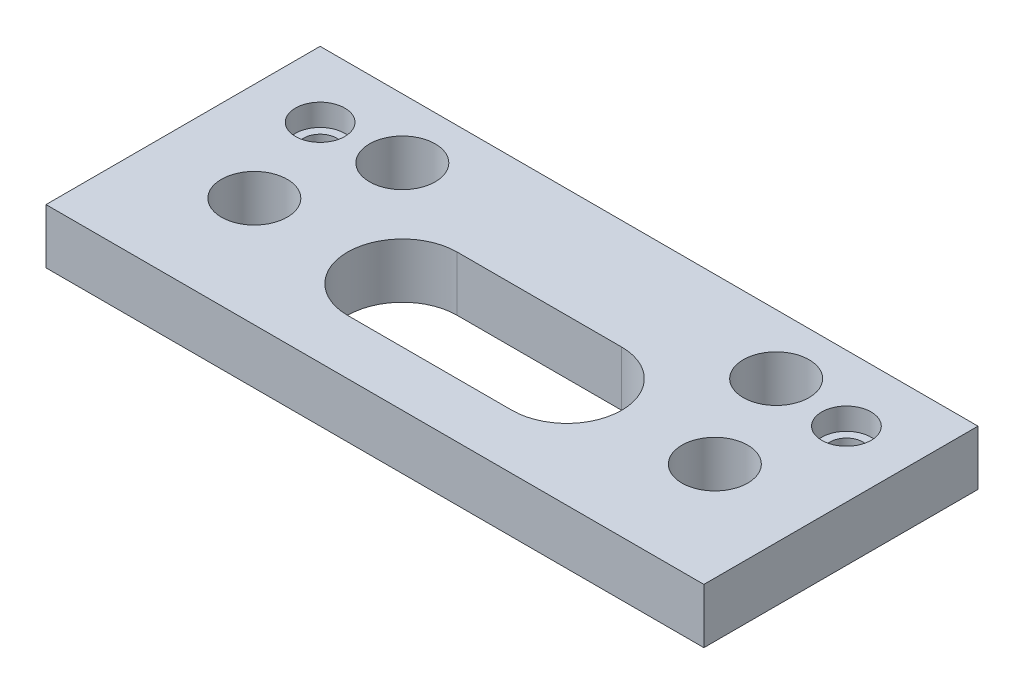
from build123d import *

# Parameters (mm, degrees)
SKETCH1_W         = 60
SKETCH1_H         = 25
SKETCH1_R         = 1.5
BODY_DEPTH        = 5
SKETCH2_R         = 2.25
SCREWHOLES_DEPTH  = 2
BUTTONHOLES_REACH = 67.192
SKETCH3_R         = 3


with BuildPart() as part:
    # Sketch1 → body (new body)
    with BuildSketch(Plane(origin=(0, 0, 0), x_dir=(1, 0, 0), z_dir=(0, 1, 0))):
        with Locations((30, 12.5)):
            Rectangle(SKETCH1_W, SKETCH1_H)
        with Locations((6, 19)):
            Circle(SKETCH1_R, mode=Mode.SUBTRACT)
        with Locations((54, 19)):
            Circle(SKETCH1_R, mode=Mode.SUBTRACT)
    extrude(amount=BODY_DEPTH)

    # Sketch2 → screwHoles (cut)
    with BuildSketch(Plane(origin=(0, 5, 0), x_dir=(1, 0, 0), z_dir=(0, 1, 0))):
        with Locations((6, 19)):
            Circle(SKETCH2_R)
        with Locations((54, 19)):
            Circle(SKETCH2_R)
    extrude(amount=-SCREWHOLES_DEPTH, mode=Mode.SUBTRACT)

    # Sketch3 → buttonHoles (cut, up to next)
    with BuildSketch(Plane(origin=(0, 5, 0), x_dir=(1, 0, 0), z_dir=(0, 1, 0)), mode=Mode.PRIVATE) as buttonholes_sk1:
        with Locations((9, 10)):
            Circle(SKETCH3_R)
    buttonholes_tool1 = extrude(buttonholes_sk1.sketch, amount=-BUTTONHOLES_REACH, mode=Mode.PRIVATE) & part.part
    # Sketch3 → buttonHoles (cut, up to next)
    with BuildSketch(Plane(origin=(0, 5, 0), x_dir=(1, 0, 0), z_dir=(0, 1, 0)), mode=Mode.PRIVATE) as buttonholes_sk2:
        with Locations((51, 10)):
            Circle(SKETCH3_R)
    buttonholes_tool2 = extrude(buttonholes_sk2.sketch, amount=-BUTTONHOLES_REACH, mode=Mode.PRIVATE) & part.part
    # Sketch3 → buttonHoles (cut, up to next)
    with BuildSketch(Plane(origin=(0, 5, 0), x_dir=(1, 0, 0), z_dir=(0, 1, 0)), mode=Mode.PRIVATE) as buttonholes_sk3:
        with Locations((12.954058454, 19.545941546)):
            Circle(SKETCH3_R)
    buttonholes_tool3 = extrude(buttonholes_sk3.sketch, amount=-BUTTONHOLES_REACH, mode=Mode.PRIVATE) & part.part
    # Sketch3 → buttonHoles (cut, up to next)
    with BuildSketch(Plane(origin=(0, 5, 0), x_dir=(1, 0, 0), z_dir=(0, 1, 0)), mode=Mode.PRIVATE) as buttonholes_sk4:
        with Locations((47.045941546, 19.545941546)):
            Circle(SKETCH3_R)
    buttonholes_tool4 = extrude(buttonholes_sk4.sketch, amount=-BUTTONHOLES_REACH, mode=Mode.PRIVATE) & part.part
    # Sketch3 → buttonHoles (cut, up to next)
    with BuildSketch(Plane(origin=(0, 5, 0), x_dir=(1, 0, 0), z_dir=(0, 1, 0)), mode=Mode.PRIVATE) as buttonholes_sk5:
        with BuildLine():
            Line((22.5, 15), (37.5, 15))
            ThreePointArc((37.5, 15), (42.5, 10), (37.5, 5))
            Line((37.5, 5), (22.5, 5))
            ThreePointArc((22.5, 5), (17.5, 10), (22.5, 15))
        make_face()
    buttonholes_tool5 = extrude(buttonholes_sk5.sketch, amount=-BUTTONHOLES_REACH, mode=Mode.PRIVATE) & part.part
    add(buttonholes_tool1.solids().sort_by_distance((9, 5, -10))[0], mode=Mode.SUBTRACT)
    add(buttonholes_tool2.solids().sort_by_distance((51, 5, -10))[0], mode=Mode.SUBTRACT)
    add(buttonholes_tool3.solids().sort_by_distance((12.954058, 5, -19.545942))[0], mode=Mode.SUBTRACT)
    add(buttonholes_tool4.solids().sort_by_distance((47.045942, 5, -19.545942))[0], mode=Mode.SUBTRACT)
    add(buttonholes_tool5.solids().sort_by_distance((30, 5, -10))[0], mode=Mode.SUBTRACT)


solid = part.part
